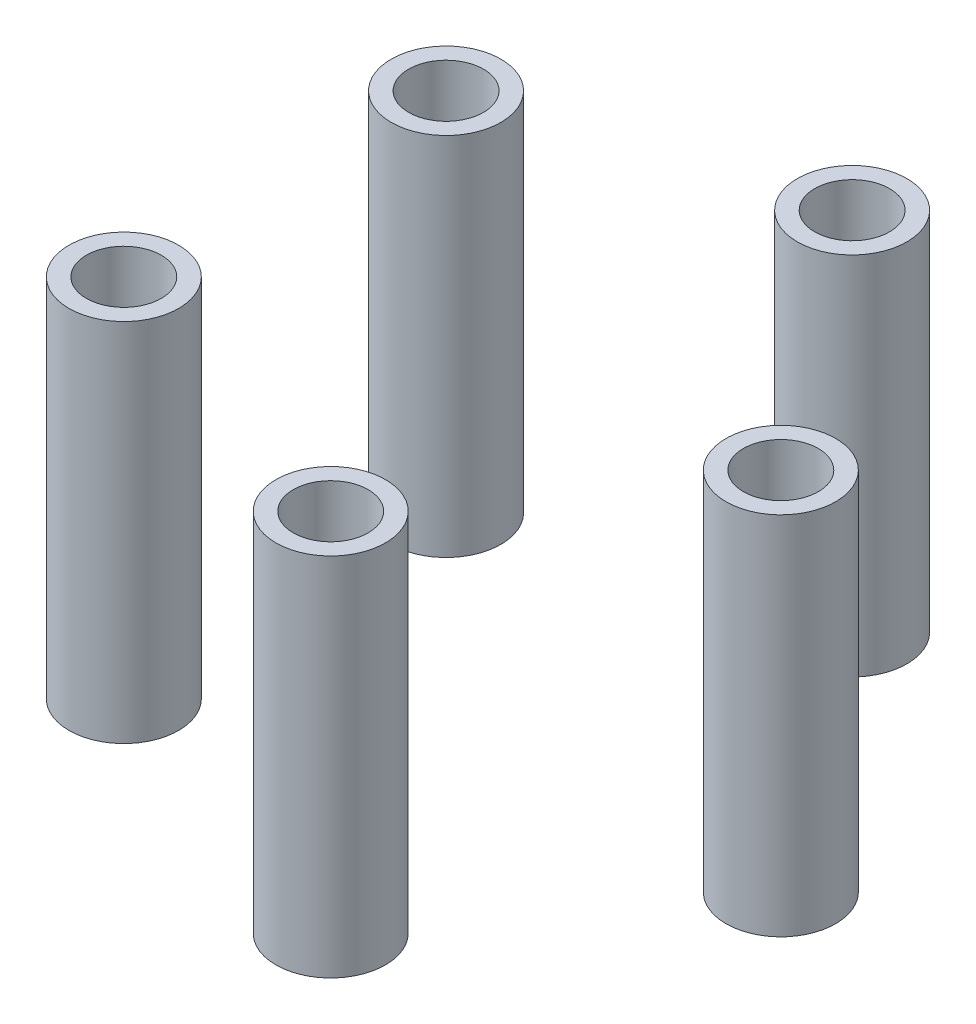
from build123d import *

# Parameters (mm, degrees)
BOSS_EXTRUDE1_DEPTH        = 10
BOSS_EXTRUDE1_DEPTH_BACK   = 10
SKETCH2_R                  = 3
SKETCH2_R_2                = 2.05
BOSS_EXTRUDE1_2_DEPTH      = 10
BOSS_EXTRUDE1_2_DEPTH_BACK = 10
BOSS_EXTRUDE1_3_DEPTH      = 10
BOSS_EXTRUDE1_3_DEPTH_BACK = 10
BOSS_EXTRUDE1_4_DEPTH      = 10
BOSS_EXTRUDE1_4_DEPTH_BACK = 10
BOSS_EXTRUDE1_5_DEPTH      = 10
BOSS_EXTRUDE1_5_DEPTH_BACK = 10


with BuildPart() as part:
    # Sketch2 → Boss-Extrude1 (new, two sides: drawn at the far end of the back side and taken through both)
    with BuildSketch(Plane(origin=(0, 0, 0), x_dir=(1, 0, 0), z_dir=(0, 1, 0)).offset(-BOSS_EXTRUDE1_DEPTH_BACK)):
        with Locations((14.2, 0.002075618)):
            Circle(SKETCH2_R)
        with Locations((14.2, 0.002075618)):
            Circle(SKETCH2_R_2, mode=Mode.SUBTRACT)
    extrude(amount=BOSS_EXTRUDE1_DEPTH + BOSS_EXTRUDE1_DEPTH_BACK)


with BuildPart() as body_2:
    # Sketch2 → Boss-Extrude1 2 (new, two sides: drawn at the far end of the back side and taken through both)
    with BuildSketch(Plane(origin=(0, 0, 0), x_dir=(1, 0, 0), z_dir=(0, 1, 0)).offset(-BOSS_EXTRUDE1_2_DEPTH_BACK)):
        with Locations((3.835254916, 14.267923362)):
            Circle(SKETCH2_R)
        with Locations((3.835254916, 14.267923362)):
            Circle(SKETCH2_R_2, mode=Mode.SUBTRACT)
    extrude(amount=BOSS_EXTRUDE1_2_DEPTH + BOSS_EXTRUDE1_2_DEPTH_BACK)


with BuildPart() as body_3:
    # Sketch2 → Boss-Extrude1 3 (new, two sides: drawn at the far end of the back side and taken through both)
    with BuildSketch(Plane(origin=(0, 0, 0), x_dir=(1, 0, 0), z_dir=(0, 1, 0)).offset(-BOSS_EXTRUDE1_3_DEPTH_BACK)):
        with Locations((-12.935254916, 8.818854402)):
            Circle(SKETCH2_R)
        with Locations((-12.935254916, 8.818854402)):
            Circle(SKETCH2_R_2, mode=Mode.SUBTRACT)
    extrude(amount=BOSS_EXTRUDE1_3_DEPTH + BOSS_EXTRUDE1_3_DEPTH_BACK)


with BuildPart() as body_4:
    # Sketch2 → Boss-Extrude1 4 (new, two sides: drawn at the far end of the back side and taken through both)
    with BuildSketch(Plane(origin=(0, 0, 0), x_dir=(1, 0, 0), z_dir=(0, 1, 0)).offset(-BOSS_EXTRUDE1_4_DEPTH_BACK)):
        with Locations((-12.935254916, -8.814703167)):
            Circle(SKETCH2_R)
        with Locations((-12.935254916, -8.814703167)):
            Circle(SKETCH2_R_2, mode=Mode.SUBTRACT)
    extrude(amount=BOSS_EXTRUDE1_4_DEPTH + BOSS_EXTRUDE1_4_DEPTH_BACK)


with BuildPart() as body_5:
    # Sketch2 → Boss-Extrude1 5 (new, two sides: drawn at the far end of the back side and taken through both)
    with BuildSketch(Plane(origin=(0, 0, 0), x_dir=(1, 0, 0), z_dir=(0, 1, 0)).offset(-BOSS_EXTRUDE1_5_DEPTH_BACK)):
        with Locations((3.835254916, -14.263772127)):
            Circle(SKETCH2_R)
        with Locations((3.835254916, -14.263772127)):
            Circle(SKETCH2_R_2, mode=Mode.SUBTRACT)
    extrude(amount=BOSS_EXTRUDE1_5_DEPTH + BOSS_EXTRUDE1_5_DEPTH_BACK)


solid = Compound([part.part, body_2.part, body_3.part, body_4.part, body_5.part])
